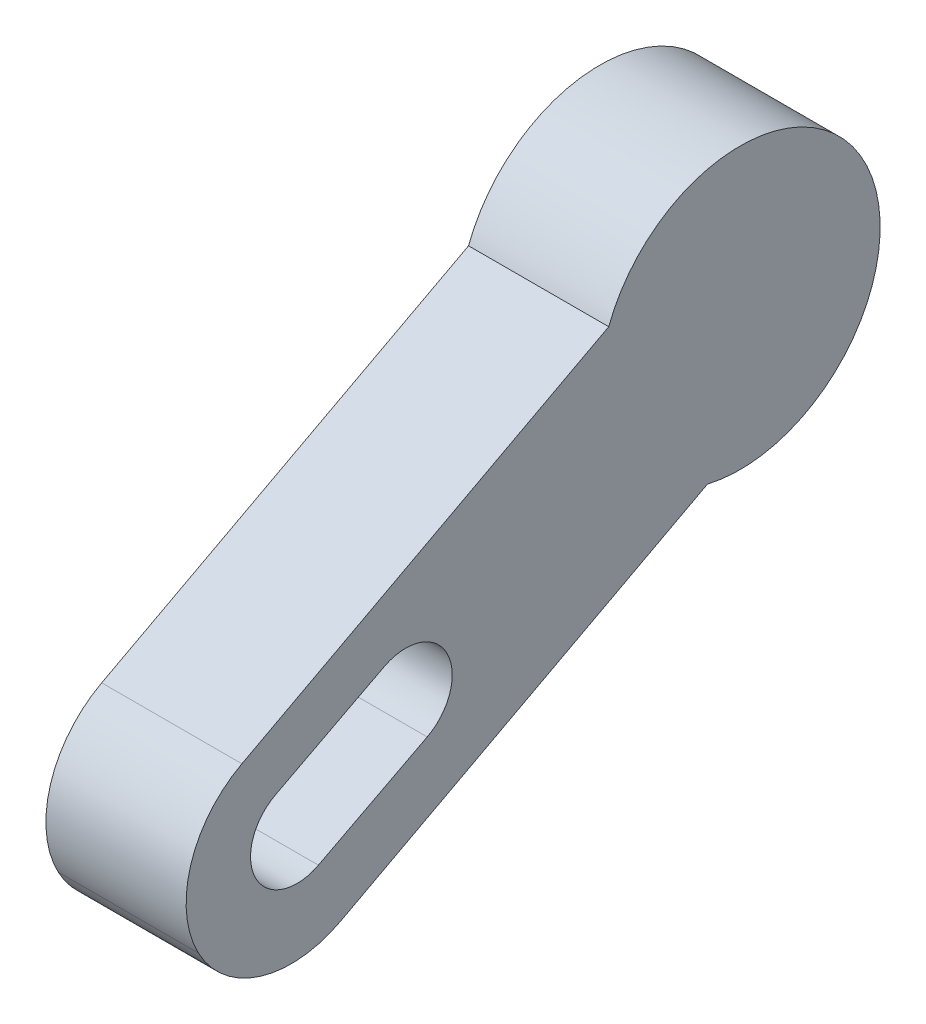
from build123d import *

# Parameters (mm, degrees)
SKETCH5_R           = 4
BOSS_EXTRUDE2_DEPTH = 4
BOSS_EXTRUDE3_DEPTH = 4
SKETCH7_R           = 2.6
CUT_EXTRUDE3_DEPTH  = 2.5
BOSS_EXTRUDE4_DEPTH = 2.5
FILLET1_R           = 0.3
CUT_EXTRUDE4_REACH  = 22.452
FILLET2_R           = 3


with BuildPart() as part:
    # Sketch5 → Boss-Extrude2 (new body)
    with BuildSketch(Plane(origin=(0, 0, 0), x_dir=(0, 0, -1), z_dir=(1, 0, 0))):
        Circle(SKETCH5_R)
    extrude(amount=BOSS_EXTRUDE2_DEPTH)

    # Sketch6 → Boss-Extrude3 (add)
    with BuildSketch(Plane(origin=(0, 0, 0), x_dir=(0, 0, -1), z_dir=(1, 0, 0))):
        Polygon((-1.408414688, 2.648842779), (1.408414688, -2.648842779), (-14.043168187, -10.864595127), (-16.859997563, -5.56690957), align=None)
    extrude(amount=BOSS_EXTRUDE3_DEPTH)

    # Sketch7 → Cut-Extrude3 (cut)
    with BuildSketch(Plane.ZY):
        Circle(SKETCH7_R)
    extrude(amount=-CUT_EXTRUDE3_DEPTH, mode=Mode.SUBTRACT)

    # Sketch8 → Boss-Extrude4 (add)
    with BuildSketch(Plane.ZY.offset(-2.5)):
        Polygon((1.6, -0.75), (-1.6, -0.75), (-1.6, 0.75), (-0.65, 0.75), (-0.65, 1.25), (0.65, 1.25), (0.65, 0.75), (1.6, 0.75), align=None)
    extrude(amount=BOSS_EXTRUDE4_DEPTH)

    # Fillet1
    fillet1_edges = [part.edges().sort_by_distance(p)[0] for p in [
        (1.25, -0.75, 1.6),
        (1.25, 0.75, 1.6),
        (1.25, 0.75, -1.6),
        (1.25, -0.75, -1.6),
    ]]
    fillet(fillet1_edges, radius=FILLET1_R)

    # Sketch10 → Cut-Extrude4 (cut, up to next)
    with BuildSketch(Plane(origin=(4, 0, 0), x_dir=(0, 0, -1), z_dir=(1, 0, 0)), mode=Mode.PRIVATE) as cut_extrude4_sk1:
        with BuildLine():
            Line((-8.923549544, -6.139086946), (-12.02808746, -7.755207093))
            ThreePointArc((-12.02808746, -7.755207093), (-13.815193727, -7.191734651), (-13.251721285, -5.404628385))
            Line((-13.251721285, -5.404628385), (-10.147183369, -3.788508238))
            ThreePointArc((-10.147183369, -3.788508238), (-8.360077103, -4.35198068), (-8.923549544, -6.139086946))
        make_face()
    cut_extrude4_tool1 = extrude(cut_extrude4_sk1.sketch, amount=-CUT_EXTRUDE4_REACH, mode=Mode.PRIVATE) & part.part
    add(cut_extrude4_tool1.solids().sort_by_distance((4, -5.771858, 11.087635))[0], mode=Mode.SUBTRACT)

    # Fillet2
    fillet2_edges = [part.edges().sort_by_distance(p)[0] for p in [
        (2, -10.864595127, 14.043168187),
        (2, -5.56690957, 16.859997563),
    ]]
    fillet(fillet2_edges, radius=FILLET2_R - 0.0001)  # a hair under: the kernel refuses the full size


solid = part.part
